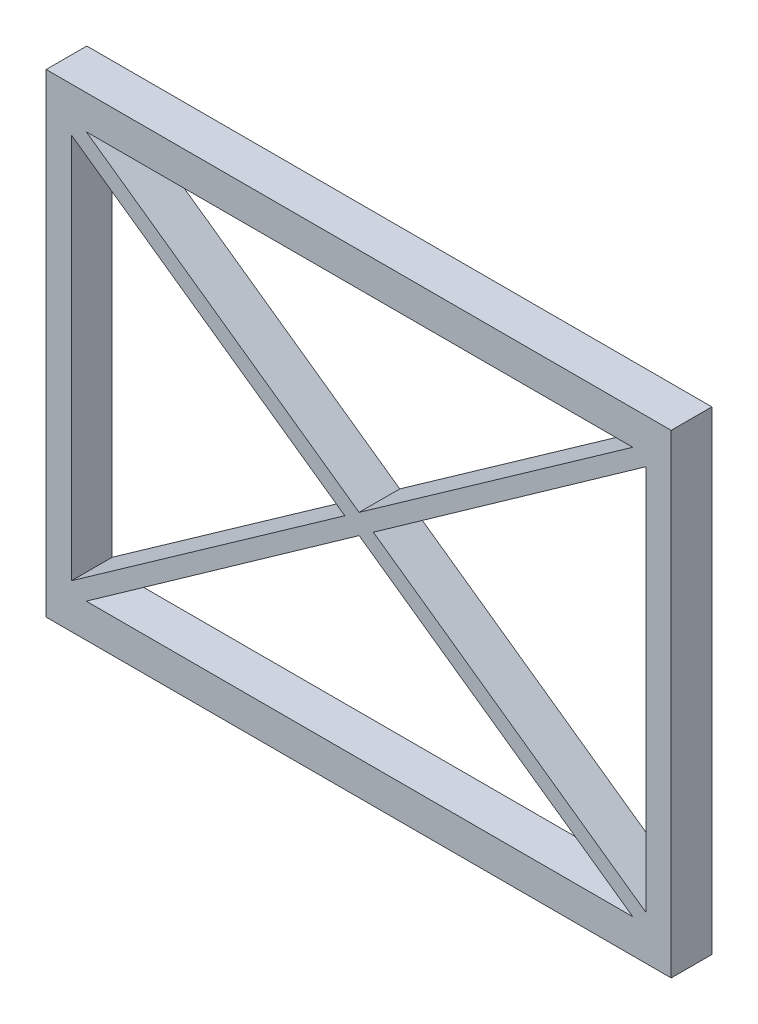
from build123d import *

# Parameters (mm, degrees)
SKETCH1_W           = 73.8
SKETCH1_H           = 4.8
BOSS_EXTRUDE1_DEPTH = 56
CUT_EXTRUDE1_DEPTH  = 56


with BuildPart() as part:
    # Sketch1 → Boss-Extrude1 (new body)
    with BuildSketch(Plane(origin=(0, 0, 0), x_dir=(1, 0, 0), z_dir=(0, 1, 0))):
        with Locations((35.965315315, -0.302702703)):
            Rectangle(SKETCH1_W, SKETCH1_H)
    extrude(amount=BOSS_EXTRUDE1_DEPTH)

    # Sketch2 → Cut-Extrude1 (cut)
    with BuildSketch(Plane.XY.offset(2.702702703)):
        Polygon((68.331260978, 52), (3.799369653, 52), (36.016550131, 29.189615872), align=None)
        Polygon((34.331260978, 28), (2.065315315, 50.775961644), (2.065315315, 5.224038356), align=None)
        Polygon((69.865315315, 5.224038356), (69.865315315, 50.775961644), (37.696752842, 28), align=None)
        Polygon((36.016550131, 26.810384128), (3.799369653, 4), (68.331260978, 4), align=None)
    extrude(amount=-CUT_EXTRUDE1_DEPTH, mode=Mode.SUBTRACT)


solid = part.part
